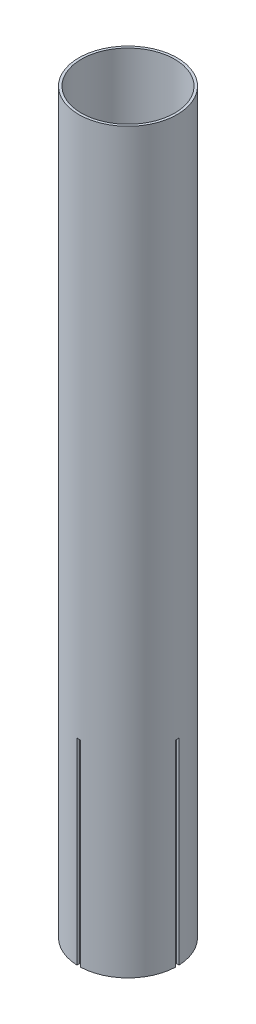
from build123d import *

# Parameters (mm, degrees)
SKETCH1_R           = 40
SKETCH1_R_2         = 38
BOSS_EXTRUDE1_DEPTH = 600
SKETCH2_W           = 3
SKETCH2_H           = 160
CUT_EXTRUDE1_DEPTH  = 603.660766933
CIRPATTERN1_COUNT   = 4


with BuildPart() as part:
    # Sketch1 → Boss-Extrude1 (new body)
    with BuildSketch(Plane(origin=(0, 0, 0), x_dir=(1, 0, 0), z_dir=(0, 1, 0))):
        Circle(SKETCH1_R)
        Circle(SKETCH1_R_2, mode=Mode.SUBTRACT)
    extrude(amount=BOSS_EXTRUDE1_DEPTH)

    # Sketch2 → Cut-Extrude1 (cut, through all)
    with BuildSketch(Plane(origin=(0, 0, 0), x_dir=(0, 0, -1), z_dir=(1, 0, 0))):
        with Locations((0, 80)):
            Rectangle(SKETCH2_W, SKETCH2_H)
    cut_extrude1 = extrude(amount=-CUT_EXTRUDE1_DEPTH, mode=Mode.SUBTRACT)

    # CirPattern1: Cut-Extrude1 ×4 about axis
    cirpattern1_axis = Axis((0, 600, 0), (0, -1, 0))
    for i in range(1, CIRPATTERN1_COUNT):
        add(cut_extrude1.rotate(cirpattern1_axis, i * 360 / CIRPATTERN1_COUNT), mode=Mode.SUBTRACT)


solid = part.part
